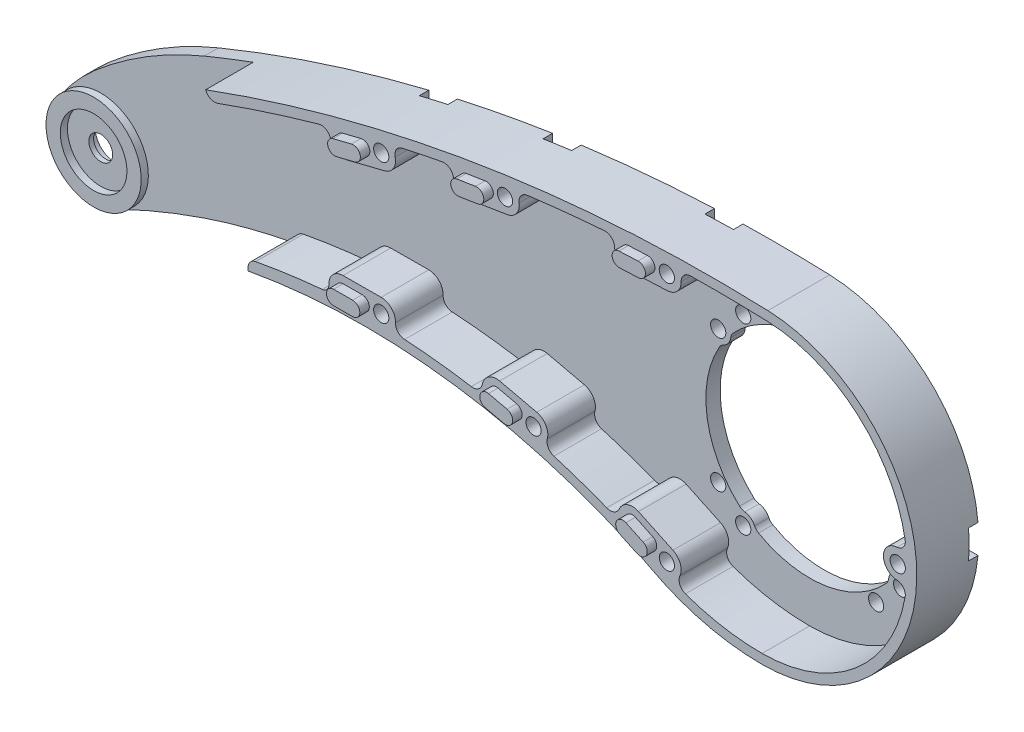
from build123d import *
from build123d.topology import SkipClean

# Parameters (mm, degrees)
SKETCH_1_R          = 1.6
EXTRUDE_1_DEPTH     = 3
EXTRUDE_START       = 10
SKETCH_2_R          = 1.6
EXTRUDE_2_DEPTH     = 10
EXTRUDE_3_DEPTH     = 2
CUT_EXTRUDE_1_REACH = 164.764
SKETCH_5_R          = 1.6
CUT_EXTRUDE_4_REACH = 164.687
SKETCH_10_R         = 2.5
SKETCH_11_R         = 4.15
CUT_EXTRUDE_5_DEPTH = 2
CUT_EXTRUDE_START   = -2
SKETCH_13_R         = 1.6
CUT_EXTRUDE_6_DEPTH = 2
EXTRUDE_START_2     = 1.5
SKETCH_14_R         = 10
SKETCH_14_R_2       = 7
EXTRUDE_4_DEPTH     = 1.5
SKETCH_15_W         = 203.491785531
SKETCH_15_H         = 102.144896266
CUT_EXTRUDE_7_DEPTH = 15


with BuildPart() as part:
    # 草图1 → 凸台-拉伸1 (new body)
    with BuildSketch(Plane.XY):
        with BuildLine():
            ThreePointArc((-23.6380873, -26.566491362), (-12.185705724, -30.993964901), (0, -32.5))
            ThreePointArc((0, -32.5), (32.494299771, -0.608672659), (1.217131806, 32.477201083))
            ThreePointArc((1.217131806, 32.477201083), (-64.206902417, 27.922113621), (-127.172269011, 9.580475598))
            ThreePointArc((-127.172269011, 9.580475598), (-139.222290641, 3.45440527), (-150.14384136, -4.511239012))
            ThreePointArc((-150.14384136, -4.511239012), (-153.910924638, -8.201852374), (-157.1671235, -12.350190882))
            ThreePointArc((-157.1671235, -12.350190882), (-156.816374649, -24.130693578), (-145.491863518, -27.395462511))
            ThreePointArc((-145.491863518, -27.395462511), (-145.026167645, -27.212412967), (-144.570211335, -27.006297405))
            ThreePointArc((-144.570211335, -27.006297405), (-136.08176084, -23.223756861), (-127.379272112, -19.963680984))
            ThreePointArc((-127.379272112, -19.963680984), (-77.471346593, -12.811545944), (-28.370763381, -24.26086005))
            ThreePointArc((-28.370763381, -24.26086005), (-25.98221149, -25.368078233), (-23.6380873, -26.566491362))
        make_face()
        with BuildLine():
            ThreePointArc((13.62552251, 16.585334135), (14.214206094, 16.415884227), (14.723986814, 16.076200182))
            ThreePointArc((14.723986814, 16.076200182), (21.531605825, 3.410271338), (18.971162667, -10.73941279))
            ThreePointArc((18.971162667, -10.73941279), (18.591300533, -11.22000242), (18.083792076, -11.563072091))
            ThreePointArc((18.083792076, -11.563072091), (17.070258581, -12.402268823), (16.585334135, -13.62552251))
            ThreePointArc((16.585334135, -13.62552251), (16.415884227, -14.214206094), (16.076200182, -14.723986814))
            ThreePointArc((16.076200182, -14.723986814), (3.410271338, -21.531605825), (-10.73941279, -18.971162667))
            ThreePointArc((-10.73941279, -18.971162667), (-11.22000242, -18.591300533), (-11.563072091, -18.083792076))
            ThreePointArc((-11.563072091, -18.083792076), (-12.402268823, -17.070258581), (-13.62552251, -16.585334135))
            ThreePointArc((-13.62552251, -16.585334135), (-14.214206094, -16.415884227), (-14.723986814, -16.076200182))
            ThreePointArc((-14.723986814, -16.076200182), (-21.531605825, -3.410271338), (-18.971162667, 10.73941279))
            ThreePointArc((-18.971162667, 10.73941279), (-18.591300533, 11.22000242), (-18.083792076, 11.563072091))
            ThreePointArc((-18.083792076, 11.563072091), (-17.070258581, 12.402268823), (-16.585334135, 13.62552251))
            ThreePointArc((-16.585334135, 13.62552251), (-16.415884227, 14.214206094), (-16.076200182, 14.723986814))
            ThreePointArc((-16.076200182, 14.723986814), (-3.410271338, 21.531605825), (10.73941279, 18.971162667))
            ThreePointArc((10.73941279, 18.971162667), (11.22000242, 18.591300533), (11.563072091, 18.083792076))
            ThreePointArc((11.563072091, 18.083792076), (12.402268823, 17.070258581), (13.62552251, 16.585334135))
        make_face(mode=Mode.SUBTRACT)
        with Locations((-13.959899742, -19.214153616)):
            Circle(SKETCH_1_R, mode=Mode.SUBTRACT)
        with Locations((13.959899742, -19.214153616)):
            Circle(SKETCH_1_R, mode=Mode.SUBTRACT)
        with Locations((-19.214153616, -13.959899742)):
            Circle(SKETCH_1_R, mode=Mode.SUBTRACT)
        with Locations((19.214153616, -13.959899742)):
            Circle(SKETCH_1_R, mode=Mode.SUBTRACT)
        with Locations((-19.214153616, 13.959899742)):
            Circle(SKETCH_1_R, mode=Mode.SUBTRACT)
        with Locations((19.214153616, 13.959899742)):
            Circle(SKETCH_1_R, mode=Mode.SUBTRACT)
        with Locations((-13.959899742, 19.214153616)):
            Circle(SKETCH_1_R, mode=Mode.SUBTRACT)
        with Locations((13.959899742, 19.214153616)):
            Circle(SKETCH_1_R, mode=Mode.SUBTRACT)
    extrude(amount=EXTRUDE_1_DEPTH)

    # 草图2 → 凸台-拉伸2 (add)
    with BuildSketch(Plane(origin=(0, 0, 0), x_dir=(-1, 0, 0), z_dir=(0, 0, -1)).offset(EXTRUDE_START)):
        with BuildLine():
            ThreePointArc((17.001102074, 28.618241459), (17.803337861, 26.493729725), (19.86429336, 25.540002931))
            Line((19.86429336, 25.540002931), (27.856104149, 25.178118556))
            ThreePointArc((27.856104149, 25.178118556), (29.994821549, 25.941676183), (30.985784325, 27.98498848))
            ThreePointArc((30.985784325, 27.98498848), (31.663067744, 29.355553639), (33.113908291, 29.837449265))
            ThreePointArc((33.113908291, 29.837449265), (41.227314196, 29.119699609), (49.318671562, 28.185646114))
            ThreePointArc((49.318671562, 28.185646114), (50.642440563, 27.420925697), (51.029255455, 25.941893607))
            ThreePointArc((51.029255455, 25.941893607), (51.587558118, 23.740659748), (53.528225459, 22.561277437))
            Line((53.528225459, 22.561277437), (61.428685658, 21.303211995))
            ThreePointArc((61.428685658, 21.303211995), (63.63968675, 21.821484643), (64.854085448, 23.740434399))
            ThreePointArc((64.854085448, 23.740434399), (65.681160173, 25.026167296), (67.176979656, 25.341897814))
            ThreePointArc((67.176979656, 25.341897814), (71.378861197, 24.513870134), (75.568707204, 23.626949189))
            ThreePointArc((75.568707204, 23.626949189), (76.820720374, 22.749666619), (77.077039123, 21.242529471))
            ThreePointArc((77.077039123, 21.242529471), (77.441191522, 19.000984157), (79.271578812, 17.656806068))
            Line((79.271578812, 17.656806068), (87.032175615, 15.714349565))
            ThreePointArc((87.032175615, 15.714349565), (89.279958958, 16.037772516), (90.657125441, 17.843470399))
            ThreePointArc((90.657125441, 17.843470399), (91.593206584, 19.052153062), (93.11086617, 19.236193992))
            ThreePointArc((93.11086617, 19.236193992), (103.776807204, 16.016684998), (114.31810295, 12.409938501))
            ThreePointArc((114.31810295, 12.409938501), (115.844352177, 12.477074745), (116.877933734, 13.602087253))
            ThreePointArc((116.877933734, 13.602087253), (58.758007498, 28.843357745), (-1.217131806, 32.477201083))
            ThreePointArc((-1.217131806, 32.477201083), (-32.494299771, -0.608672659), (0, -32.5))
            ThreePointArc((0, -32.5), (12.185705724, -30.993964901), (23.6380873, -26.566491362))
            ThreePointArc((23.6380873, -26.566491362), (25.98221149, -25.368078233), (28.370763381, -24.26086005))
            ThreePointArc((28.370763381, -24.26086005), (67.447729657, -13.61728358), (107.927773367, -14.906110424))
            ThreePointArc((107.927773367, -14.906110424), (107.695689541, -13.31299597), (106.364851219, -12.407045681))
            ThreePointArc((106.364851219, -12.407045681), (99.391116414, -11.276937995), (92.373119817, -10.465862006))
            ThreePointArc((92.373119817, -10.465862006), (91.369760144, -9.952693966), (90.997090026, -8.889120247))
            ThreePointArc((90.997090026, -8.889120247), (90.171344421, -6.688722952), (88.012925285, -5.758760104))
            Line((88.012925285, -5.758760104), (80.013000401, -5.724092368))
            ThreePointArc((80.013000401, -5.724092368), (77.84660248, -6.635313587), (77.001817369, -8.828471625))
            ThreePointArc((77.001817369, -8.828471625), (76.473178092, -10.269527622), (75.088620305, -10.932175043))
            ThreePointArc((75.088620305, -10.932175043), (68.061013416, -11.534031926), (61.073151389, -12.492820013))
            ThreePointArc((61.073151389, -12.492820013), (59.57674153, -12.150972965), (58.744053794, -10.861502918))
            ThreePointArc((58.744053794, -10.861502918), (57.437519935, -8.907897702), (55.123740646, -8.49555141))
            Line((55.123740646, -8.49555141), (47.327397155, -10.289158996))
            ThreePointArc((47.327397155, -10.289158996), (45.426416956, -11.671142477), (45.104931619, -13.999285781))
            ThreePointArc((45.104931619, -13.999285781), (44.919437274, -15.522996291), (43.722847368, -16.484388233))
            ThreePointArc((43.722847368, -16.484388233), (38.132797804, -18.285074645), (32.624096936, -20.321085557))
            ThreePointArc((32.624096936, -20.321085557), (31.089233, -20.303922581), (30.002334443, -19.220062167))
            ThreePointArc((30.002334443, -19.220062167), (28.311680005, -17.587490076), (25.963057786, -17.674540277))
            Line((25.963057786, -17.674540277), (18.723451368, -21.078669963))
            ThreePointArc((18.723451368, -21.078669963), (17.187310183, -22.750078076), (17.261694817, -25.018954835))
            ThreePointArc((17.261694817, -25.018954835), (17.275070203, -26.622295223), (16.106540278, -27.720210117))
            ThreePointArc((16.106540278, -27.720210117), (8.172329404, -29.799953184), (0, -30.5))
            ThreePointArc((0, -30.5), (-19.662506126, -23.315999932), (-30.062360099, -5.148252645))
            ThreePointArc((-30.062360099, -5.148252645), (-29.685338806, -3.685938076), (-28.342105263, -2.995841994))
            ThreePointArc((-28.342105263, -2.995841994), (-25.5, 0), (-28.342105263, 2.995841994))
            ThreePointArc((-28.342105263, 2.995841994), (-29.685338806, 3.685938076), (-30.062360099, 5.148252645))
            ThreePointArc((-30.062360099, 5.148252645), (-20.095728615, 22.943663427), (-1.142231387, 30.478604093))
            ThreePointArc((-1.142231387, 30.478604093), (6.952265997, 30.674453283), (15.049110071, 30.655457646))
            ThreePointArc((15.049110071, 30.655457646), (16.450460044, 30.044409415), (17.001102074, 28.618241459))
        make_face()
        with Locations((20, -23.793522369)):
            Circle(SKETCH_2_R, mode=Mode.SUBTRACT)
        with Locations((-28.5, 0)):
            Circle(SKETCH_2_R, mode=Mode.SUBTRACT)
        with Locations((48, -13.212787805)):
            Circle(SKETCH_2_R, mode=Mode.SUBTRACT)
        with Locations((80, -8.724064199)):
            Circle(SKETCH_2_R, mode=Mode.SUBTRACT)
        with Locations((20, 28.536931977)):
            Circle(SKETCH_2_R, mode=Mode.SUBTRACT)
        with Locations((54, 25.523950011)):
            Circle(SKETCH_2_R, mode=Mode.SUBTRACT)
        with Locations((80, 20.567029869)):
            Circle(SKETCH_2_R, mode=Mode.SUBTRACT)
    extrude(amount=-EXTRUDE_2_DEPTH)

    # 草图4 → 凸台-拉伸3 (add)
    with BuildSketch(Plane(origin=(0, 0, -10), x_dir=(-1, 0, 0), z_dir=(0, 0, -1))):
        with BuildLine():
            Line((24.258077525, -23.44888373), (27.877880734, -21.746818887))
            ThreePointArc((27.877880734, -21.746818887), (28.597032621, -19.751118368), (26.601332102, -19.031966481))
            Line((26.601332102, -19.031966481), (22.981528893, -20.734031323))
            ThreePointArc((22.981528893, -20.734031323), (22.262377006, -22.729731843), (24.258077525, -23.44888373))
        make_face()
        with BuildLine():
            Line((23.928052075, 26.857525267), (27.92395747, 26.67658308))
            ThreePointArc((27.92395747, 26.67658308), (29.490275313, 28.107194282), (28.05966411, 29.673512126))
            Line((28.05966411, 29.673512126), (24.063758715, 29.854454313))
            ThreePointArc((24.063758715, 29.854454313), (22.497440872, 28.42384311), (23.928052075, 26.857525267))
        make_face()
        with BuildLine():
            Line((83.516087807, 18.140689717), (87.396386209, 17.169461466))
            ThreePointArc((87.396386209, 17.169461466), (89.215708703, 18.260362772), (88.124807397, 20.079685267))
            Line((88.124807397, 20.079685267), (84.244508996, 21.050913518))
            ThreePointArc((84.244508996, 21.050913518), (82.425186501, 19.960012212), (83.516087807, 18.140689717))
        make_face()
        with BuildLine():
            Line((83.993462241, -10.241383983), (87.993424683, -10.258717851))
            ThreePointArc((87.993424683, -10.258717851), (89.4999108, -8.765232136), (88.006425084, -7.25874602))
            Line((88.006425084, -7.25874602), (84.006462642, -7.241412152))
            ThreePointArc((84.006462642, -7.241412152), (82.499976526, -8.734897867), (83.993462241, -10.241383983))
        make_face()
        with BuildLine():
            Line((52.234473168, -13.777798416), (56.132644913, -12.880994623))
            ThreePointArc((56.132644913, -12.880994623), (57.258157895, -11.082878796), (55.460042069, -9.957365814))
            Line((55.460042069, -9.957365814), (51.561870323, -10.854169607))
            ThreePointArc((51.561870323, -10.854169607), (50.436357341, -12.652285434), (52.234473168, -13.777798416))
        make_face()
        with BuildLine():
            Line((57.714342829, 23.413581003), (61.664572928, 22.784548282))
            ThreePointArc((61.664572928, 22.784548282), (63.381796485, 24.029997299), (62.136347469, 25.747220857))
            Line((62.136347469, 25.747220857), (58.186117369, 26.376253578))
            ThreePointArc((58.186117369, 26.376253578), (56.468893812, 25.130804561), (57.714342829, 23.413581003))
        make_face()
    extrude(amount=EXTRUDE_3_DEPTH)

    # 草图5 → 切除-拉伸1 (cut, up to next)
    with BuildSketch(Plane(origin=(0, 0, -10), x_dir=(-1, 0, 0), z_dir=(0, 0, -1)), mode=Mode.PRIVATE) as cut_extrude_1_sk1:
        with Locations((-28.5, 0)):
            Circle(SKETCH_5_R)
    cut_extrude_1_tool1 = extrude(cut_extrude_1_sk1.sketch, amount=-CUT_EXTRUDE_1_REACH, mode=Mode.PRIVATE) & part.part
    # 草图5 → 切除-拉伸1 (cut, up to next)
    with BuildSketch(Plane(origin=(0, 0, -10), x_dir=(-1, 0, 0), z_dir=(0, 0, -1)), mode=Mode.PRIVATE) as cut_extrude_1_sk2:
        with Locations((80, -8.724064199)):
            Circle(SKETCH_5_R)
    cut_extrude_1_tool2 = extrude(cut_extrude_1_sk2.sketch, amount=-CUT_EXTRUDE_1_REACH, mode=Mode.PRIVATE) & part.part
    # 草图5 → 切除-拉伸1 (cut, up to next)
    with BuildSketch(Plane(origin=(0, 0, -10), x_dir=(-1, 0, 0), z_dir=(0, 0, -1)), mode=Mode.PRIVATE) as cut_extrude_1_sk3:
        with Locations((54, 25.523950011)):
            Circle(SKETCH_5_R)
    cut_extrude_1_tool3 = extrude(cut_extrude_1_sk3.sketch, amount=-CUT_EXTRUDE_1_REACH, mode=Mode.PRIVATE) & part.part
    # 草图5 → 切除-拉伸1 (cut, up to next)
    with BuildSketch(Plane(origin=(0, 0, -10), x_dir=(-1, 0, 0), z_dir=(0, 0, -1)), mode=Mode.PRIVATE) as cut_extrude_1_sk4:
        with Locations((80, 20.567029869)):
            Circle(SKETCH_5_R)
    cut_extrude_1_tool4 = extrude(cut_extrude_1_sk4.sketch, amount=-CUT_EXTRUDE_1_REACH, mode=Mode.PRIVATE) & part.part
    # 草图5 → 切除-拉伸1 (cut, up to next)
    with BuildSketch(Plane(origin=(0, 0, -10), x_dir=(-1, 0, 0), z_dir=(0, 0, -1)), mode=Mode.PRIVATE) as cut_extrude_1_sk5:
        with Locations((48, -13.212787805)):
            Circle(SKETCH_5_R)
    cut_extrude_1_tool5 = extrude(cut_extrude_1_sk5.sketch, amount=-CUT_EXTRUDE_1_REACH, mode=Mode.PRIVATE) & part.part
    # 草图5 → 切除-拉伸1 (cut, up to next)
    with BuildSketch(Plane(origin=(0, 0, -10), x_dir=(-1, 0, 0), z_dir=(0, 0, -1)), mode=Mode.PRIVATE) as cut_extrude_1_sk6:
        with Locations((20, -23.793522369)):
            Circle(SKETCH_5_R)
    cut_extrude_1_tool6 = extrude(cut_extrude_1_sk6.sketch, amount=-CUT_EXTRUDE_1_REACH, mode=Mode.PRIVATE) & part.part
    # 草图5 → 切除-拉伸1 (cut, up to next)
    with BuildSketch(Plane(origin=(0, 0, -10), x_dir=(-1, 0, 0), z_dir=(0, 0, -1)), mode=Mode.PRIVATE) as cut_extrude_1_sk7:
        with Locations((20, 28.536931977)):
            Circle(SKETCH_5_R)
    cut_extrude_1_tool7 = extrude(cut_extrude_1_sk7.sketch, amount=-CUT_EXTRUDE_1_REACH, mode=Mode.PRIVATE) & part.part
    add(cut_extrude_1_tool1.solids().sort_by_distance((28.5, 0, -10))[0], mode=Mode.SUBTRACT)
    add(cut_extrude_1_tool2.solids().sort_by_distance((-80, -8.724064, -10))[0], mode=Mode.SUBTRACT)
    add(cut_extrude_1_tool3.solids().sort_by_distance((-54, 25.52395, -10))[0], mode=Mode.SUBTRACT)
    add(cut_extrude_1_tool4.solids().sort_by_distance((-80, 20.56703, -10))[0], mode=Mode.SUBTRACT)
    add(cut_extrude_1_tool5.solids().sort_by_distance((-48, -13.212788, -10))[0], mode=Mode.SUBTRACT)
    add(cut_extrude_1_tool6.solids().sort_by_distance((-20, -23.793522, -10))[0], mode=Mode.SUBTRACT)
    add(cut_extrude_1_tool7.solids().sort_by_distance((-20, 28.536932, -10))[0], mode=Mode.SUBTRACT)

    # 草图10 → 切除-拉伸4 (cut, up to next)
    with BuildSketch(Plane(origin=(0, 0, 0), x_dir=(-1, 0, 0), z_dir=(0, 0, -1)), mode=Mode.PRIVATE) as cut_extrude_4_sk1:
        with Locations((148.916083752, -18)):
            Circle(SKETCH_10_R)
    cut_extrude_4_tool1 = extrude(cut_extrude_4_sk1.sketch, amount=-CUT_EXTRUDE_4_REACH, mode=Mode.PRIVATE) & part.part
    add(cut_extrude_4_tool1.solids().sort_by_distance((-148.916084, -18, 0))[0], mode=Mode.SUBTRACT)

    # 草图11 → 切除-拉伸5 (cut)
    with BuildSketch(Plane.XY.offset(3)):
        with Locations((-148.916083752, -18)):
            Circle(SKETCH_11_R)
    extrude(amount=-CUT_EXTRUDE_5_DEPTH, mode=Mode.SUBTRACT)

    # 草图13 → 切除-拉伸6 (cut)
    # profile 1 of 7: a face of its own
    with BuildSketch(Plane.XY.offset(3).offset(CUT_EXTRUDE_START)):
        with BuildLine():
            ThreePointArc((-83, -12.683698856), (-79.999180454, -12.725284006), (-77, -12.832819462))
            Line((-77, -12.832819462), (-77, -8.724064199))
            ThreePointArc((-77, -8.724064199), (-80, -5.724064199), (-83, -8.724064199))
            Line((-83, -8.724064199), (-83, -12.683698856))
        make_face()
        with Locations((-80, -8.724064199)):
            Circle(SKETCH_13_R, mode=Mode.SUBTRACT)
    # profile 2 of 7: a face of its own
    with BuildSketch(Plane.XY.offset(3).offset(CUT_EXTRUDE_START)):
        with BuildLine():
            ThreePointArc((-51, -16.581282722), (-47.990836106, -17.352586143), (-45, -18.1921549))
            Line((-45, -18.1921549), (-45, -13.212787805))
            ThreePointArc((-45, -13.212787805), (-48, -10.212787805), (-51, -13.212787805))
            Line((-51, -13.212787805), (-51, -16.581282722))
        make_face()
        with Locations((-48, -13.212787805)):
            Circle(SKETCH_13_R, mode=Mode.SUBTRACT)
    # profile 3 of 7: a face of its own
    with BuildSketch(Plane.XY.offset(3).offset(CUT_EXTRUDE_START)):
        with BuildLine():
            ThreePointArc((-23, -26.902477601), (-20.04292434, -28.311736195), (-17, -29.524550153))
            Line((-17, -29.524550153), (-17, -23.793522369))
            ThreePointArc((-17, -23.793522369), (-20, -20.793522369), (-23, -23.793522369))
            Line((-23, -23.793522369), (-23, -26.902477601))
        make_face()
        with Locations((-20, -23.793522369)):
            Circle(SKETCH_13_R, mode=Mode.SUBTRACT)
    # profile 4 of 7: a face of its own
    with BuildSketch(Plane.XY.offset(3).offset(CUT_EXTRUDE_START)):
        with BuildLine():
            ThreePointArc((32.361242251, -3), (32.5, 0), (32.361242251, 3))
            Line((32.361242251, 3), (28.5, 3))
            ThreePointArc((28.5, 3), (25.5, 0), (28.5, -3))
            Line((28.5, -3), (32.361242251, -3))
        make_face()
        with Locations((28.5, 0)):
            Circle(SKETCH_13_R, mode=Mode.SUBTRACT)
    # profile 5 of 7: a face of its own
    with BuildSketch(Plane.XY.offset(3).offset(CUT_EXTRUDE_START)):
        with BuildLine():
            ThreePointArc((-17, 32.619234927), (-20.000463964, 32.53894641), (-23, 32.429338848))
            Line((-23, 32.429338848), (-23, 28.536931977))
            ThreePointArc((-23, 28.536931977), (-20, 25.536931977), (-17, 28.536931977))
            Line((-17, 28.536931977), (-17, 32.619234927))
        make_face()
        with Locations((-20, 28.536931977)):
            Circle(SKETCH_13_R, mode=Mode.SUBTRACT)
    # profile 6 of 7: a face of its own
    with BuildSketch(Plane.XY.offset(3).offset(CUT_EXTRUDE_START)):
        with BuildLine():
            ThreePointArc((-51, 29.981954991), (-54.002128749, 29.565339979), (-57, 29.119119123))
            Line((-57, 29.119119123), (-57, 25.523950011))
            ThreePointArc((-57, 25.523950011), (-54, 22.523950011), (-51, 25.523950011))
            Line((-51, 25.523950011), (-51, 29.981954991))
        make_face()
        with Locations((-54, 25.523950011)):
            Circle(SKETCH_13_R, mode=Mode.SUBTRACT)
    # profile 7 of 7: a face of its own
    with BuildSketch(Plane.XY.offset(3).offset(CUT_EXTRUDE_START)):
        with BuildLine():
            Line((-83, 23.960592486), (-83, 20.567029869))
            ThreePointArc((-83, 20.567029869), (-80, 17.567029869), (-77, 20.567029869))
            Line((-77, 20.567029869), (-77, 25.359108824))
            ThreePointArc((-77, 25.359108824), (-80.003506771, 24.674895616), (-83, 23.960592486))
        make_face()
        with Locations((-80, 20.567029869)):
            Circle(SKETCH_13_R, mode=Mode.SUBTRACT)
    extrude(amount=CUT_EXTRUDE_6_DEPTH, mode=Mode.SUBTRACT)

    # 草图14 → 凸台-拉伸4 (add)
    with BuildSketch(Plane(origin=(0, 0, 0), x_dir=(-1, 0, 0), z_dir=(0, 0, -1)).offset(EXTRUDE_START_2)):
        with Locations((148.916083752, -18)):
            Circle(SKETCH_14_R)
        with Locations((148.916083752, -18)):
            Circle(SKETCH_14_R_2, mode=Mode.SUBTRACT)
    extrude(amount=-EXTRUDE_4_DEPTH)

    # 镜向1: part across plane


with BuildPart() as part_1:
    add(part.part)
    add(part.part.mirror(Plane.XY.offset(3)))

    # 草图15 → 切除-拉伸7 (cut)
    with SkipClean():  # the faces are left unmerged after this step: merging them gives an invalid solid
        with BuildSketch(Plane(origin=(0, 0, -12), x_dir=(-1, 0, 0), z_dir=(0, 0, -1))):
            with Locations((66.100817259, 6.081379258)):
                Rectangle(SKETCH_15_W, SKETCH_15_H)
        extrude(amount=-CUT_EXTRUDE_7_DEPTH, mode=Mode.SUBTRACT)


solid = part_1.part
